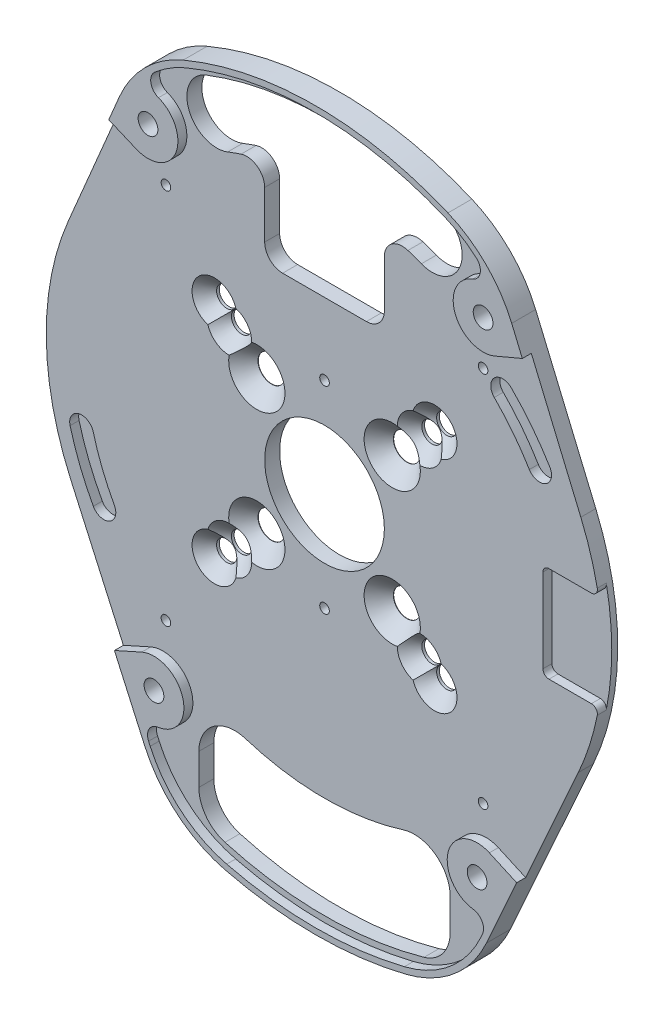
from build123d import *

# Parameters (mm, degrees)
SKETCH1_R                                      = 10
BOSS_EXTRUDE1_DEPTH                            = 2.5
M2X0_4_TAPPED_HOLE1_D                          = 1.6
FILLET1_R                                      = 6
SKETCH5_W                                      = 20
SKETCH5_H                                      = 16.000000000000004
CUT_EXTRUDE1_DEPTH                             = 79.34219807996199
FILLET2_R                                      = 3
SKETCH6_W                                      = 10
SKETCH6_H                                      = 16
CUT_EXTRUDE2_DEPTH                             = 1.5
CUT_EXTRUDE3_START                             = -1.5
CUT_EXTRUDE3_DEPTH                             = 1.5
FILLET4_R                                      = 20
BOSS_EXTRUDE2_DEPTH                            = 6
FILLET11_R                                     = 1
FILLET5_R                                      = 1
SKETCH9_R                                      = 4.999999999999999
SKETCH9_R_2                                    = 4.9999999999999964
BOSS_EXTRUDE3_DEPTH                            = 1.5
FILLET8_R                                      = 2
M3_CLEARANCE_HOLE1_D                           = 3.3
CUT_EXTRUDE4_DEPTH                             = 6
CSK_FOR_M4_FLAT_HEAD_MACHINE_SCREW2_AT_2_COUNT = 2
CSK_FOR_M4_FLAT_HEAD_MACHINE_SCREW2_AT_2_PITCH = 15.999999999999996
CSK_FOR_M4_FLAT_HEAD_MACHINE_SCREW2_AT_3_COUNT = 2
CSK_FOR_M4_FLAT_HEAD_MACHINE_SCREW2_AT_3_PITCH = 15.999999999999996
CSK_FOR_M4_FLAT_HEAD_MACHINE_SCREW2_AT_4_COUNT = 2
CSK_FOR_M4_FLAT_HEAD_MACHINE_SCREW2_AT_4_PITCH = 15.999999999999995
CSK_FOR_M4_FLAT_HEAD_MACHINE_SCREW2_AT_5_COUNT = 2
CSK_FOR_M4_FLAT_HEAD_MACHINE_SCREW2_AT_5_PITCH = 15.999999999999996
CSK_FOR_M3_FLAT_HEAD_MACHINE_SCREW1_AT_2_COUNT = 2
CSK_FOR_M3_FLAT_HEAD_MACHINE_SCREW1_AT_2_PITCH = 22.5
CSK_FOR_M3_FLAT_HEAD_MACHINE_SCREW1_AT_3_COUNT = 2
CSK_FOR_M3_FLAT_HEAD_MACHINE_SCREW1_AT_3_PITCH = 22.5
CSK_FOR_M3_FLAT_HEAD_MACHINE_SCREW1_AT_4_COUNT = 2
CSK_FOR_M3_FLAT_HEAD_MACHINE_SCREW1_AT_4_PITCH = 22.499999999999993
CSK_FOR_M3_FLAT_HEAD_MACHINE_SCREW1_AT_5_COUNT = 2
CSK_FOR_M3_FLAT_HEAD_MACHINE_SCREW1_AT_5_PITCH = 22.5
CSK_FOR_M3_FLAT_HEAD_MACHINE_SCREW2_AT_2_COUNT = 2
CSK_FOR_M3_FLAT_HEAD_MACHINE_SCREW2_AT_2_PITCH = 25.999999999999996
CSK_FOR_M3_FLAT_HEAD_MACHINE_SCREW2_AT_3_COUNT = 2
CSK_FOR_M3_FLAT_HEAD_MACHINE_SCREW2_AT_3_PITCH = 25.999999999999993
CSK_FOR_M3_FLAT_HEAD_MACHINE_SCREW2_AT_4_COUNT = 2
CSK_FOR_M3_FLAT_HEAD_MACHINE_SCREW2_AT_4_PITCH = 25.999999999999993
CSK_FOR_M3_FLAT_HEAD_MACHINE_SCREW2_AT_5_COUNT = 2
CSK_FOR_M3_FLAT_HEAD_MACHINE_SCREW2_AT_5_PITCH = 25.999999999999996
CSK_FOR_M3_FLAT_HEAD_MACHINE_SCREW2_AT_6_COUNT = 2
CSK_FOR_M3_FLAT_HEAD_MACHINE_SCREW2_AT_6_PITCH = 74.46866969010533
CUT_EXTRUDE5_START                             = -6
CUT_EXTRUDE5_DEPTH                             = 6
DELETEFACE1_START                              = 2.5
DELETEFACE1_DEPTH                              = 1.5
CUT_EXTRUDE6_DEPTH                             = 4.5
CUT_EXTRUDE7_START                             = -4.5
SKETCH29_R                                     = 62.999999999999986
CUT_EXTRUDE7_DEPTH                             = 4.5


# Read off the part's stored shape, not the designer's step: DeleteFace1
with BuildPart() as part:
    # Sketch1 → Boss-Extrude1 (new body)
    with BuildSketch(Plane.XY):
        with BuildLine():
            Line((42.4170636611873, -19.053679706628415), (25.000000000000007, -57.82732917920383))
            ThreePointArc((25.000000000000007, -57.82732917920383), (3.86e-15, -62.99999999999999), (-24.999999999999993, -57.827329179203836))
            Line((-24.999999999999993, -57.827329179203836), (-42.4170636611873, -19.053679706628426))
            ThreePointArc((-42.4170636611873, -19.053679706628426), (-46.49709497865921, -0.5197677804020838), (-42.83239410639522, 18.10071863530396))
            Line((-42.83239410639522, 18.10071863530396), (-30.000000000000007, 48.466483264210524))
            ThreePointArc((-30.000000000000007, 48.466483264210524), (-9.17e-15, 56.99999999999999), (29.999999999999993, 48.46648326421053))
            Line((29.999999999999993, 48.46648326421053), (42.83239410639522, 18.10071863530397))
            ThreePointArc((42.83239410639522, 18.10071863530397), (46.497094978659206, -0.5197677804020868), (42.4170636611873, -19.053679706628415))
        make_face()
        Circle(SKETCH1_R, mode=Mode.SUBTRACT)
        with BuildLine():
            Line((21.000000000000007, -57.271284253105414), (21.000000000000007, -38.665229858362395))
            ThreePointArc((21.000000000000007, -38.665229858362395), (2.69e-15, -43.99999999999999), (-21, -38.6652298583624))
            Line((-21, -38.6652298583624), (-20.999999999999993, -57.27128425310542))
            ThreePointArc((-20.999999999999993, -57.27128425310542), (3.74e-15, -61.00000000000001), (21.000000000000007, -57.271284253105414))
        make_face(mode=Mode.SUBTRACT)
        with BuildLine():
            ThreePointArc((19.81818181818181, 50.768983340436186), (3.34e-15, 54.49999999999999), (-19.81818181818182, 50.768983340436186))
            ThreePointArc((-19.81818181818182, 50.768983340436186), (-22.657704893618003, 44.29309662863638), (-16.181818181818187, 41.453573553200194))
            ThreePointArc((-16.181818181818187, 41.453573553200194), (-7.16e-15, 44.50000000000001), (16.18181818181818, 41.4535735532002))
            ThreePointArc((16.18181818181818, 41.4535735532002), (22.65770489361799, 44.293096628636384), (19.81818181818181, 50.768983340436186))
        make_face(mode=Mode.SUBTRACT)
    extrude(amount=BOSS_EXTRUDE1_DEPTH)

    # M2x0.4 Tapped Hole1 (through all)
    with Locations(Plane.XY.offset(2.5)):
        with Locations((0, 0), (26.5, -31.5), (-26.5, 31.5), (-26.5, -31.5), (26.5, 31.5), (0, 16.5), (0, -16.5)):
            Hole(M2X0_4_TAPPED_HOLE1_D / 2)

    # Fillet1
    fillet1_edges = [part.edges().sort_by_distance(p)[0] for p in [
        (-20.999999999999996, -57.27128425310542, 1.25),
        (21.000000000000007, -57.27128425310542, 1.25),
        (21.000000000000007, -38.665229858362395, 1.25),
        (-21, -38.66522985836241, 1.25),
    ]]
    fillet(fillet1_edges, radius=FILLET1_R)

    # Sketch5 → Cut-Extrude1 (cut, through all)
    with BuildSketch(Plane.XY.offset(2.5)):
        with Locations((3.55e-15, 36.50000000000001)):
            Rectangle(SKETCH5_W, SKETCH5_H)
    extrude(amount=-CUT_EXTRUDE1_DEPTH, mode=Mode.SUBTRACT)

    # Fillet2
    fillet2_edges = [part.edges().sort_by_distance(p)[0] for p in [
        (-9.999999999999996, 43.36184959154763, 1.25),
        (10.000000000000004, 43.36184959154763, 1.25),
        (10.000000000000004, 28.500000000000004, 1.25),
        (-9.999999999999996, 28.500000000000004, 1.25),
    ]]
    fillet(fillet2_edges, radius=FILLET2_R)

    # Sketch6 → Cut-Extrude2 (cut)
    with BuildSketch(Plane.XY.offset(2.5)):
        with Locations((41.5, 0)):
            Rectangle(SKETCH6_W, SKETCH6_H)
    extrude(amount=-CUT_EXTRUDE2_DEPTH, mode=Mode.SUBTRACT)

    # Sketch7 → Cut-Extrude3 (cut)
    with BuildSketch(Plane.XY.offset(2.5).offset(CUT_EXTRUDE3_START)):
        with BuildLine():
            ThreePointArc((37.65079489632768, 22.76878660962557), (34.672473158695716, 27.089104914329013), (31.20100801196362, 31.024137361695992))
            ThreePointArc((31.20100801196362, 31.024137361695992), (28.37259231316092, 31.03217693670816), (28.364552738148753, 28.203761237905457))
            ThreePointArc((28.364552738148753, 28.203761237905457), (31.52043014426884, 24.62645901302638), (34.227995360297896, 20.698896917841438))
            ThreePointArc((34.227995360297896, 20.698896917841438), (36.97433997420486, 20.022441995718612), (37.65079489632768, 22.76878660962557))
        make_face()
        with BuildLine():
            ThreePointArc((-42.51800726538746, -11.323385455792845), (-40.86762032636466, -16.304527250432876), (-38.63597696766534, -21.053771247784436))
            ThreePointArc((-38.63597696766534, -21.053771247784436), (-35.922806594235794, -21.852962416869936), (-35.1236154251503, -19.13979204344039))
            ThreePointArc((-35.1236154251503, -19.13979204344039), (-37.15238211487695, -14.8222975003935), (-38.65273387762495, -10.293986777993489))
            ThreePointArc((-38.65273387762495, -10.293986777993489), (-41.10006991040587, -8.876049423011917), (-42.51800726538746, -11.323385455792845))
        make_face()
    extrude(amount=CUT_EXTRUDE3_DEPTH, mode=Mode.SUBTRACT)

    # Fillet4
    fillet4_edges = [part.edges().sort_by_distance(p)[0] for p in [
        (25.00000000000001, -57.827329179203836, 1.25),
        (-24.999999999999993, -57.82732917920384, 1.25),
        (-30.000000000000007, 48.466483264210524, 1.25),
        (29.999999999999993, 48.466483264210524, 1.25),
    ]]
    fillet(fillet4_edges, radius=FILLET4_R)

    # Sketch8 → Boss-Extrude2 (add)
    with BuildSketch(Plane.XY.offset(2.5)):
        with BuildLine():
            Line((42.83239410639522, 18.10071863530397), (32.78104454677229, 41.88559559589108))
            ThreePointArc((32.78104454677229, 41.88559559589108), (28.491471575678375, 48.25164344124892), (22.119865905219072, 52.53295663043464))
            ThreePointArc((22.119865905219072, 52.53295663043464), (-9.17e-15, 57), (-22.119865905219086, 52.532956630434626))
            ThreePointArc((-22.119865905219086, 52.532956630434626), (-28.49147157567839, 48.25164344124891), (-32.78104454677229, 41.88559559589107))
            Line((-32.78104454677229, 41.88559559589107), (-42.83239410639522, 18.100718635303952))
            ThreePointArc((-42.83239410639522, 18.100718635303952), (-46.49709497865921, -0.5197677804020838), (-42.4170636611873, -19.053679706628426))
            Line((-42.4170636611873, -19.053679706628426), (-28.541191758133415, -49.94397233926688))
            ThreePointArc((-28.541191758133415, -49.94397233926688), (-23.108312906942977, -57.10715432248089), (-15.086732204228996, -61.166906995514154))
            ThreePointArc((-15.086732204228996, -61.166906995514154), (3.86e-15, -62.999999999999986), (15.086732204228992, -61.166906995514154))
            ThreePointArc((15.086732204228992, -61.166906995514154), (23.108312906942995, -57.107154322480895), (28.54119175813343, -49.94397233926687))
            Line((28.54119175813343, -49.94397233926687), (42.4170636611873, -19.053679706628415))
            Line((42.4170636611873, -19.053679706628415), (41.504868743742406, -18.643923153797697))
            Line((41.504868743742406, -18.643923153797697), (27.628996840688544, -49.53421578643615))
            ThreePointArc((27.628996840688544, -49.53421578643615), (22.46776193205762, -56.33923867048948), (14.847260264479306, -60.19600370987107))
            ThreePointArc((14.847260264479306, -60.19600370987107), (-9.97e-15, -61.99999999999998), (-14.847260264479326, -60.196003709871064))
            ThreePointArc((-14.847260264479326, -60.196003709871064), (-22.467761932057613, -56.339238670489465), (-27.628996840688522, -49.534215786436164))
            Line((-27.628996840688522, -49.534215786436164), (-41.50486874374241, -18.6439231537977))
            ThreePointArc((-41.50486874374241, -18.6439231537977), (-45.49715745223643, -0.5085899786730066), (-41.91126735141898, 17.711455868953326))
            Line((-41.91126735141898, 17.711455868953326), (-31.859917791796054, 41.49633282954044))
            ThreePointArc((-31.859917791796054, 41.49633282954044), (-27.784823469256843, 47.544078282630394), (-21.73179808232051, 51.611325812356824))
            ThreePointArc((-21.73179808232051, 51.611325812356824), (-9.01e-15, 55.99999999999999), (21.73179808232049, 51.61132581235683))
            ThreePointArc((21.73179808232049, 51.61132581235683), (27.784823469256825, 47.54407828263041), (31.859917791796047, 41.496332829540464))
            Line((31.859917791796047, 41.496332829540464), (41.91126735141898, 17.711455868953347))
            ThreePointArc((41.91126735141898, 17.711455868953347), (43.62231976794835, 12.93612067286258), (44.791182167922294, 8))
            Line((44.791182167922294, 8), (45.80665890457413, 8))
            ThreePointArc((45.80665890457413, 8), (44.606351105058486, 13.1348178933797), (42.83239410639522, 18.10071863530397))
        make_face()
    extrude(amount=BOSS_EXTRUDE2_DEPTH)

    # Fillet11
    fillet11_edges = [part.edges().sort_by_distance(p)[0] for p in [
        (45.806658904574135, 8, 4.75),
    ]]
    fillet(fillet11_edges, radius=FILLET11_R)

    # Fillet5
    fillet5_edges = [part.edges().sort_by_distance(p)[0] for p in [
        (45.80665890457413, -7.999999999999999, 1.75),
        (36.5, 8, 1.75),
        (36.5, -8, 1.75),
    ]]
    fillet(fillet5_edges, radius=FILLET5_R)

    # Sketch9 → Boss-Extrude3 (add)
    with BuildSketch(Plane.XY.offset(2.5)):
        with Locations((28, 40.338107136850155)):
            Circle(SKETCH9_R)
        with Locations((-28, 40.338107136850155)):
            Circle(SKETCH9_R)
        with Locations((26.999999999999996, -41.17258677729498)):
            Circle(SKETCH9_R_2)
        with Locations((-27.000000000000004, -41.17258677729498)):
            Circle(SKETCH9_R)
    extrude(amount=BOSS_EXTRUDE3_DEPTH)

    # Fillet8
    fillet8_edges = [part.edges().sort_by_distance(p)[0] for p in [
        (32.85483250749601, 39.14202966270395, 3.25),
        (29.966379389155495, 44.935209713245904, 3.25),
        (-29.966379389155488, 44.93520971324591, 3.25),
        (-32.85483250749601, 39.14202966270395, 3.25),
        (31.878049328271707, -40.07502823628321, 3.25),
        (29.419510011287407, -45.54819774095251, 3.25),
        (-29.41951001128738, -45.54819774095253, 3.25),
        (-31.878049328271707, -40.075028236283174, 3.25),
    ]]
    fillet(fillet8_edges, radius=FILLET8_R)

    # M3 Clearance Hole1 (through all)
    with Locations(Plane.XY.offset(4)):
        with Locations((-28, 40.338107137), (28, 40.338107137), (27, -41.172586777), (-27, -41.172586777)):
            Hole(M3_CLEARANCE_HOLE1_D / 2)

    # Sketch14 → Cut-Extrude4 (cut)
    with BuildSketch(Plane.XY.offset(8.5)):
        Polygon((-39.96495351966587, 22.317089643834535), (-40.886080274642104, 22.70635241018516), (-36.60418984478526, 32.83874671492381), (-35.68306308980902, 32.44948394857318), align=None)
    extrude(amount=-CUT_EXTRUDE4_DEPTH, mode=Mode.SUBTRACT)

    # Sketch22 → CSK for M4 Flat Head Machine Screw2 (revolve, cut)
    with BuildSketch(Plane(origin=(0, 0, 2.5), x_dir=(0, -1, 0), z_dir=(1, 0, 0))):
        Polygon((0, 0), (-6.1e-16, 2.4999999999999996), (2.25, 2.4999999999999996), (2.249999999999988, 2.4500000000000077), (4.699999999999999, -1.73e-15), align=None)
    csk_for_m4_flat_head_machine_screw2 = revolve(axis=Axis((0, 0, 8.84999999999999), (0, 0, -1)), mode=Mode.SUBTRACT)

    # CSK for M4 Flat Head Machine Screw2 at 2: CSK for M4 Flat Head Machine Screw2 ×2
    with Locations(*[Vector(0.7071067811865477, -0.7071067811865475, 0) * (i * CSK_FOR_M4_FLAT_HEAD_MACHINE_SCREW2_AT_2_PITCH) for i in range(1, CSK_FOR_M4_FLAT_HEAD_MACHINE_SCREW2_AT_2_COUNT)]):
        add(csk_for_m4_flat_head_machine_screw2, mode=Mode.SUBTRACT)

    # CSK for M4 Flat Head Machine Screw2 at 3: CSK for M4 Flat Head Machine Screw2 ×2
    with Locations(*[Vector(-0.7071067811865476, 0.7071067811865475, 0) * (i * CSK_FOR_M4_FLAT_HEAD_MACHINE_SCREW2_AT_3_PITCH) for i in range(1, CSK_FOR_M4_FLAT_HEAD_MACHINE_SCREW2_AT_3_COUNT)]):
        add(csk_for_m4_flat_head_machine_screw2, mode=Mode.SUBTRACT)

    # CSK for M4 Flat Head Machine Screw2 at 4: CSK for M4 Flat Head Machine Screw2 ×2
    with Locations(*[Vector(-0.7071067811865476, -0.7071067811865475, 0) * (i * CSK_FOR_M4_FLAT_HEAD_MACHINE_SCREW2_AT_4_PITCH) for i in range(1, CSK_FOR_M4_FLAT_HEAD_MACHINE_SCREW2_AT_4_COUNT)]):
        add(csk_for_m4_flat_head_machine_screw2, mode=Mode.SUBTRACT)

    # CSK for M4 Flat Head Machine Screw2 at 5: CSK for M4 Flat Head Machine Screw2 ×2
    with Locations(*[Vector(0.7071067811865476, 0.7071067811865476, 0) * (i * CSK_FOR_M4_FLAT_HEAD_MACHINE_SCREW2_AT_5_PITCH) for i in range(1, CSK_FOR_M4_FLAT_HEAD_MACHINE_SCREW2_AT_5_COUNT)]):
        add(csk_for_m4_flat_head_machine_screw2, mode=Mode.SUBTRACT)

    # Sketch24 → CSK for M3 Flat Head Machine Screw1 (revolve, cut)
    with BuildSketch(Plane(origin=(0, 0, 2.5), x_dir=(0, -1, 0), z_dir=(1, 0, 0))):
        Polygon((0, 0), (-6.1e-16, 2.4999999999999996), (1.699999999999999, 2.4999999999999996), (1.6999999999999993, 2.05), (3.75, 0), align=None)
    csk_for_m3_flat_head_machine_screw1 = revolve(axis=Axis((0, 0, 8.84999999999999), (0, 0, -1)), mode=Mode.SUBTRACT)

    # CSK for M3 Flat Head Machine Screw1 at 2: CSK for M3 Flat Head Machine Screw1 ×2
    with Locations(*[Vector(0.7071067811865478, -0.7071067811865474, 0) * (i * CSK_FOR_M3_FLAT_HEAD_MACHINE_SCREW1_AT_2_PITCH) for i in range(1, CSK_FOR_M3_FLAT_HEAD_MACHINE_SCREW1_AT_2_COUNT)]):
        add(csk_for_m3_flat_head_machine_screw1, mode=Mode.SUBTRACT)

    # CSK for M3 Flat Head Machine Screw1 at 3: CSK for M3 Flat Head Machine Screw1 ×2
    with Locations(*[Vector(-0.7071067811865475, 0.7071067811865477, 0) * (i * CSK_FOR_M3_FLAT_HEAD_MACHINE_SCREW1_AT_3_PITCH) for i in range(1, CSK_FOR_M3_FLAT_HEAD_MACHINE_SCREW1_AT_3_COUNT)]):
        add(csk_for_m3_flat_head_machine_screw1, mode=Mode.SUBTRACT)

    # CSK for M3 Flat Head Machine Screw1 at 4: CSK for M3 Flat Head Machine Screw1 ×2
    with Locations(*[Vector(-0.7071067811865476, -0.7071067811865476, 0) * (i * CSK_FOR_M3_FLAT_HEAD_MACHINE_SCREW1_AT_4_PITCH) for i in range(1, CSK_FOR_M3_FLAT_HEAD_MACHINE_SCREW1_AT_4_COUNT)]):
        add(csk_for_m3_flat_head_machine_screw1, mode=Mode.SUBTRACT)

    # CSK for M3 Flat Head Machine Screw1 at 5: CSK for M3 Flat Head Machine Screw1 ×2
    with Locations(*[Vector(0.7071067811865475, 0.7071067811865477, 0) * (i * CSK_FOR_M3_FLAT_HEAD_MACHINE_SCREW1_AT_5_PITCH) for i in range(1, CSK_FOR_M3_FLAT_HEAD_MACHINE_SCREW1_AT_5_COUNT)]):
        add(csk_for_m3_flat_head_machine_screw1, mode=Mode.SUBTRACT)

    # Sketch26 → CSK for M3 Flat Head Machine Screw2 (revolve, cut)
    with BuildSketch(Plane(origin=(0, 0, 2.5), x_dir=(0, -1, 0), z_dir=(1, 0, 0))):
        Polygon((0, 0), (-6.1e-16, 2.4999999999999996), (1.699999999999999, 2.4999999999999996), (1.6999999999999993, 2.05), (3.75, 0), align=None)
    csk_for_m3_flat_head_machine_screw2 = revolve(axis=Axis((0, 0, 8.84999999999999), (0, 0, -1)), mode=Mode.SUBTRACT)

    # CSK for M3 Flat Head Machine Screw2 at 2: CSK for M3 Flat Head Machine Screw2 ×2
    with Locations(*[Vector(0.7071067811865476, -0.7071067811865475, 0) * (i * CSK_FOR_M3_FLAT_HEAD_MACHINE_SCREW2_AT_2_PITCH) for i in range(1, CSK_FOR_M3_FLAT_HEAD_MACHINE_SCREW2_AT_2_COUNT)]):
        add(csk_for_m3_flat_head_machine_screw2, mode=Mode.SUBTRACT)

    # CSK for M3 Flat Head Machine Screw2 at 3: CSK for M3 Flat Head Machine Screw2 ×2
    with Locations(*[Vector(-0.7071067811865475, 0.7071067811865476, 0) * (i * CSK_FOR_M3_FLAT_HEAD_MACHINE_SCREW2_AT_3_PITCH) for i in range(1, CSK_FOR_M3_FLAT_HEAD_MACHINE_SCREW2_AT_3_COUNT)]):
        add(csk_for_m3_flat_head_machine_screw2, mode=Mode.SUBTRACT)

    # CSK for M3 Flat Head Machine Screw2 at 4: CSK for M3 Flat Head Machine Screw2 ×2
    with Locations(*[Vector(-0.7071067811865475, -0.7071067811865476, 0) * (i * CSK_FOR_M3_FLAT_HEAD_MACHINE_SCREW2_AT_4_PITCH) for i in range(1, CSK_FOR_M3_FLAT_HEAD_MACHINE_SCREW2_AT_4_COUNT)]):
        add(csk_for_m3_flat_head_machine_screw2, mode=Mode.SUBTRACT)

    # CSK for M3 Flat Head Machine Screw2 at 5: CSK for M3 Flat Head Machine Screw2 ×2
    with Locations(*[Vector(0.7071067811865476, 0.7071067811865475, 0) * (i * CSK_FOR_M3_FLAT_HEAD_MACHINE_SCREW2_AT_5_PITCH) for i in range(1, CSK_FOR_M3_FLAT_HEAD_MACHINE_SCREW2_AT_5_COUNT)]):
        add(csk_for_m3_flat_head_machine_screw2, mode=Mode.SUBTRACT)

    # CSK for M3 Flat Head Machine Screw2 at 6: CSK for M3 Flat Head Machine Screw2 ×2
    with Locations(*[Vector(-0.9158645328276496, 0.40148743132057263, 0) * (i * CSK_FOR_M3_FLAT_HEAD_MACHINE_SCREW2_AT_6_PITCH) for i in range(1, CSK_FOR_M3_FLAT_HEAD_MACHINE_SCREW2_AT_6_COUNT)]):
        add(csk_for_m3_flat_head_machine_screw2, mode=Mode.SUBTRACT)

    # Sketch27 → Cut-Extrude5 (cut)
    with BuildSketch(Plane.XY.offset(8.5).offset(CUT_EXTRUDE5_START)):
        with BuildLine():
            Line((-33.397510188845956, -36.69242345620812), (-41.50486874374242, -18.64392315379768))
            ThreePointArc((-41.50486874374242, -18.64392315379768), (-45.497157452236436, -0.5085899786730067), (-41.91126735141898, 17.71145586895333))
            Line((-41.91126735141898, 17.71145586895333), (-39.96495351966587, 22.317089643834535))
            Line((-39.96495351966587, 22.317089643834535), (-40.886080274642104, 22.70635241018516))
            Line((-40.886080274642104, 22.70635241018516), (-42.83239410639522, 18.100718635303952))
            ThreePointArc((-42.83239410639522, 18.100718635303952), (-46.49709497865921, -0.5197677804020838), (-42.417063661187306, -19.053679706628415))
            Line((-42.417063661187306, -19.053679706628415), (-33.609757351378036, -38.66039495422414))
            Line((-33.609757351378036, -38.66039495422414), (-31.822047961907373, -37.85735864818501))
            ThreePointArc((-31.822047961907373, -37.85735864818501), (-32.76220815772582, -37.48103664997912), (-33.397510188845956, -36.69242345620812))
        make_face()
        with BuildLine():
            Line((-34.55777620863636, 37.68125032675671), (-32.755415079818285, 36.91958308044526))
            ThreePointArc((-32.755415079818285, 36.91958308044526), (-33.68477318770329, 36.52176224794312), (-34.30085401220273, 35.720255962784734))
            Line((-34.30085401220273, 35.720255962784734), (-35.683063089809025, 32.44948394857319))
            Line((-35.683063089809025, 32.44948394857319), (-36.60418984478526, 32.83874671492381))
            Line((-36.60418984478526, 32.83874671492381), (-34.55777620863636, 37.68125032675671))
        make_face()
        with BuildLine():
            Line((34.55777620863636, 37.681250326756704), (32.75541507981831, 36.91958308044526))
            ThreePointArc((32.75541507981831, 36.91958308044526), (33.684773187703314, 36.521762247943116), (34.300854012202734, 35.72025596278473))
            Line((34.300854012202734, 35.72025596278473), (41.91126735141897, 17.711455868953344))
            ThreePointArc((41.91126735141897, 17.711455868953344), (43.61977101469149, 12.944712303712286), (44.788027321887725, 8.017643582364993))
            ThreePointArc((44.788027321887725, 8.017643582364993), (45.430959409296094, 8.44216288482993), (45.581250912300646, 9.197802197802206))
            ThreePointArc((45.581250912300646, 9.197802197802206), (44.430379659038216, 13.718285729409715), (42.83239410639522, 18.10071863530397))
            Line((42.83239410639522, 18.10071863530397), (34.55777620863636, 37.681250326756704))
        make_face()
        with BuildLine():
            Line((33.60975735137802, -38.66039495422413), (31.82204796190738, -37.85735864818502))
            ThreePointArc((31.82204796190738, -37.85735864818502), (32.76220815772582, -37.481036649979124), (33.397510188845956, -36.692423456208125))
            Line((33.397510188845956, -36.692423456208125), (41.504868743742406, -18.643923153797697))
            Line((41.504868743742406, -18.643923153797697), (42.4170636611873, -19.053679706628415))
            Line((42.4170636611873, -19.053679706628415), (33.60975735137802, -38.66039495422413))
        make_face()
    extrude(amount=CUT_EXTRUDE5_DEPTH, mode=Mode.SUBTRACT)

    # DeleteFace1 outline → DeleteFace1 (add)
    with BuildSketch(Plane.XY.offset(DELETEFACE1_START)):
        with BuildLine():
            Line((-32.75541508, 36.91958308), (-29.946313832, 35.732473362))
            ThreePointArc((-29.946313832, 35.732473362), (-30.59285426, 36.062933832), (-31.184714644, 36.483552346))
            ThreePointArc((-31.184714644, 36.483552346), (-31.923625949, 36.868853215), (-32.75541508, 36.91958308))
        make_face()
        with BuildLine():
            Line((-29.048782764, -36.61161219), (-31.822047962, -37.857358648))
            ThreePointArc((-31.822047962, -37.857358648), (-30.994366739, -37.78734088), (-30.266514539, -37.387103615))
            ThreePointArc((-30.266514539, -37.387103615), (-29.685785377, -36.955175615), (-29.048782764, -36.61161219))
        make_face()
        with BuildLine():
            Line((31.822047962, -37.857358648), (29.048782764, -36.61161219))
            ThreePointArc((29.048782764, -36.61161219), (29.685785377, -36.955175615), (30.266514539, -37.387103615))
            ThreePointArc((30.266514539, -37.387103615), (30.994366739, -37.78734088), (31.822047962, -37.857358648))
        make_face()
        with BuildLine():
            Line((29.946313832, 35.732473362), (32.75541508, 36.91958308))
            ThreePointArc((32.75541508, 36.91958308), (31.923625949, 36.868853215), (31.184714644, 36.483552346))
            ThreePointArc((31.184714644, 36.483552346), (30.59285426, 36.062933832), (29.946313832, 35.732473362))
        make_face()
    extrude(amount=DELETEFACE1_DEPTH)

    # Sketch28 → Cut-Extrude6 (cut)
    with BuildSketch(Plane.XY.offset(8.5)):
        with BuildLine():
            Line((-28.734596128759748, 48.004588962196976), (-28.015791794684137, 47.30937652753106))
            ThreePointArc((-28.015791794684137, 47.30937652753106), (-30.206659833598223, 44.58061361128771), (-31.85991779179606, 41.496332829540435))
            Line((-31.85991779179606, 41.496332829540435), (-33.636649453660134, 37.29198756040609))
            Line((-33.636649453660134, 37.29198756040609), (-34.55777620863636, 37.68125032675671))
            Line((-34.55777620863636, 37.68125032675671), (-32.78104454677229, 41.88559559589106))
            ThreePointArc((-32.78104454677229, 41.88559559589106), (-31.040773011827202, 45.13220694509872), (-28.734596128759748, 48.004588962196976))
        make_face()
        Polygon((-29.51219182307085, -47.78234412867302), (-28.59999690562595, -47.37258757584229), (-32.697562433933136, -38.25063840139342), (-33.609757351378036, -38.66039495422414), align=None)
    cut_extrude6 = extrude(amount=-CUT_EXTRUDE6_DEPTH, mode=Mode.SUBTRACT)

    # Mirror1: Cut-Extrude6 across plane
    add(cut_extrude6.mirror(Plane(origin=(0, 0, 0), x_dir=(0, 0, 1), z_dir=(1, 0, 0))), mode=Mode.SUBTRACT)

    # Sketch29 → Cut-Extrude7 (cut)
    with BuildSketch(Plane.XY.offset(8.5).offset(CUT_EXTRUDE7_START)):
        Circle(SKETCH29_R)
    extrude(amount=CUT_EXTRUDE7_DEPTH, mode=Mode.SUBTRACT)


solid = part.part
